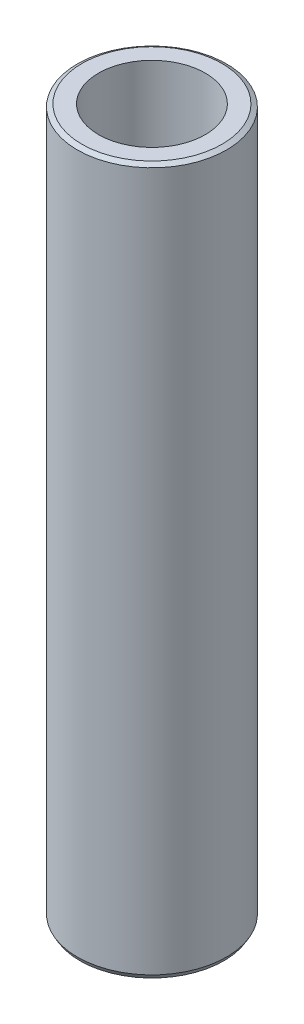
from build123d import *
from OCP.BRepFilletAPI import BRepFilletAPI_MakeChamfer

# Parameters (mm, degrees)
SKETCH1_R           = 25
BOSS_EXTRUDE1_DEPTH = 236.6287211
SKETCH2_R           = 17.882812096
CUT_EXTRUDE1_DEPTH  = 240.255410909
CHAMFER1_SIZE       = 0.88419133
CHAMFER1_SIZE2      = 1.531464308


with BuildPart() as part:
    # Sketch1 → Boss-Extrude1 (new body)
    with BuildSketch(Plane(origin=(0, 0, 0), x_dir=(1, 0, 0), z_dir=(0, 1, 0))):
        Circle(SKETCH1_R)
    extrude(amount=BOSS_EXTRUDE1_DEPTH)

    # Sketch2 → Cut-Extrude1 (cut, through all)
    with BuildSketch(Plane(origin=(0, 0, 0), x_dir=(1, 0, 0), z_dir=(0, 1, 0))):
        Circle(SKETCH2_R)
    extrude(amount=CUT_EXTRUDE1_DEPTH, mode=Mode.SUBTRACT)

    # Chamfer1: one chamfer whose edges measure the first distance from different faces: ONE call of the kernel's chamfer builder (chamfer() names one face for all edges)
    chamfer1_edges_1 = [part.edges().sort_by_distance(p)[0] for p in [
        (-25, 236.6287211, 0),
    ]]
    chamfer1_side_1 = [part.faces().sort_by_distance(p)[0] for p in [
        (-25, 118.31436055, 0),
    ]]
    chamfer1_edges_2 = [part.edges().sort_by_distance(p)[0] for p in [
        (-25, 0, 0),
    ]]
    chamfer1_side_2 = [part.faces().sort_by_distance(p)[0] for p in [
        (-24.292893219, 0, 0),
    ]]
    chamfer1 = BRepFilletAPI_MakeChamfer(part.part.solid().wrapped)
    for e in chamfer1_edges_1:
        chamfer1.Add(CHAMFER1_SIZE, CHAMFER1_SIZE2, e.wrapped, chamfer1_side_1[0].wrapped)  # the first distance lies on this face
    for e in chamfer1_edges_2:
        chamfer1.Add(CHAMFER1_SIZE, CHAMFER1_SIZE2, e.wrapped, chamfer1_side_2[0].wrapped)  # the first distance lies on this face
    add(Compound.cast(chamfer1.Shape()), mode=Mode.REPLACE)


solid = part.part
